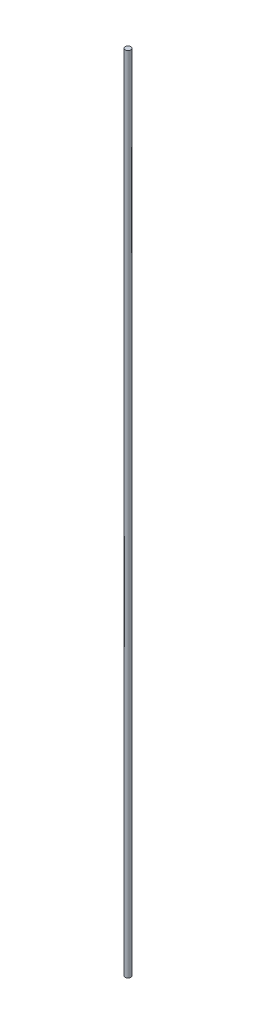
from build123d import *

# Parameters (mm, degrees)
SKETCH_2_W = 2.5
SKETCH_2_H = 705.85


with BuildPart() as part:
    # Эскиз2 → Повернуть1 (revolve)
    with BuildSketch(Plane.XY):
        with Locations((-1.25, -128.276481828)):
            Rectangle(SKETCH_2_W, SKETCH_2_H)
    revolve(axis=Axis((-2.5, 224.648518172, 0), (0, -1, 0)))


solid = part.part
